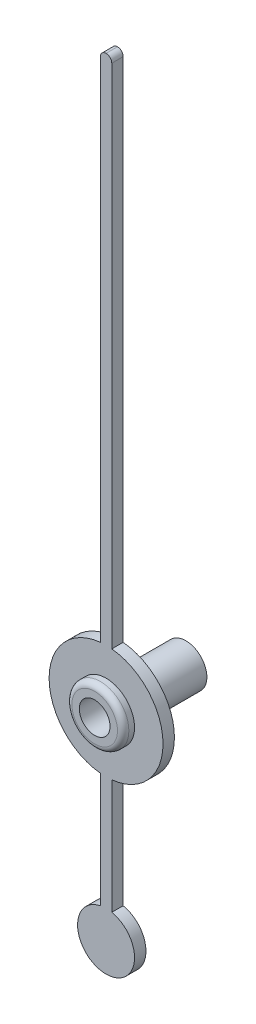
from build123d import *

# Parameters (mm, degrees)
BOSS_EXTRUDE1_DEPTH      = 0.1
FILLET1_R                = 0.05
BOSS_EXTRUDE2_DEPTH      = 0.2
BOSS_EXTRUDE2_DEPTH_BACK = 0.1
SKETCH2_R                = 0.25
CUT_EXTRUDE2_DEPTH       = 6.028916384
CUT_EXTRUDE2_DEPTH_BACK  = 6.028916384
SKETCH3_R                = 0.135
FILLET2_R                = 0.05
SKETCH4_R                = 0.185
SKETCH4_R_2              = 0.135
BOSS_EXTRUDE3_DEPTH      = 0.5


with BuildPart() as part:
    # Sketch1 → Boss-Extrude1 (new body)
    with BuildSketch(Plane.XY):
        with BuildLine():
            Line((-0.05, 5), (0.05, 5))
            Line((0.05, 5), (0.05, 0.497493719))
            ThreePointArc((0.05, 0.497493719), (0.5, 0), (0.05, -0.497493719))
            Line((0.05, -0.497493719), (0.05, -1.505051026))
            ThreePointArc((0.05, -1.505051026), (0, -2), (-0.05, -1.505051026))
            Line((-0.05, -1.505051026), (-0.05, -0.497493719))
            ThreePointArc((-0.05, -0.497493719), (-0.5, 0), (-0.05, 0.497493719))
            Line((-0.05, 0.497493719), (-0.05, 5))
        make_face()
    extrude(amount=BOSS_EXTRUDE1_DEPTH)

    # Fillet1
    fillet1_edges = [part.edges().sort_by_distance(p)[0] for p in [
        (-0.05, 5, 0.05),
        (0.05, 5, 0.05),
    ]]
    fillet(fillet1_edges, radius=FILLET1_R - 0.0001)  # a hair under: the kernel refuses the full size

    # Sketch2 → Boss-Extrude2 (add, two sides: drawn at the far end of the back side and taken through both)
    with BuildSketch(Plane.XY.offset(-BOSS_EXTRUDE2_DEPTH_BACK)):
        Circle(SKETCH2_R)
    extrude(amount=BOSS_EXTRUDE2_DEPTH + BOSS_EXTRUDE2_DEPTH_BACK)

    # Sketch3 → Cut-Extrude2 (cut, two sides: drawn at the far end of the back side and taken through both)
    with BuildSketch(Plane.XY.offset(-CUT_EXTRUDE2_DEPTH_BACK)):
        Circle(SKETCH3_R)
    extrude(amount=CUT_EXTRUDE2_DEPTH + CUT_EXTRUDE2_DEPTH_BACK, mode=Mode.SUBTRACT)

    # Fillet2
    fillet2_edges = [part.edges().sort_by_distance(p)[0] for p in [
        (-0.25, 0, -0.1),
        (-0.25, 0, 0.2),
    ]]
    fillet(fillet2_edges, radius=FILLET2_R)

    # Sketch4 → Boss-Extrude3 (add)
    with BuildSketch(Plane(origin=(0, 0, -0.1), x_dir=(-1, 0, 0), z_dir=(0, 0, -1))):
        with Locations(Location((0, 0, 0), (0, 0, 180))):
            Circle(SKETCH4_R)
        with Locations(Location((0, 0, 0), (0, 0, 180))):
            Circle(SKETCH4_R_2, mode=Mode.SUBTRACT)
    extrude(amount=BOSS_EXTRUDE3_DEPTH)


solid = part.part
